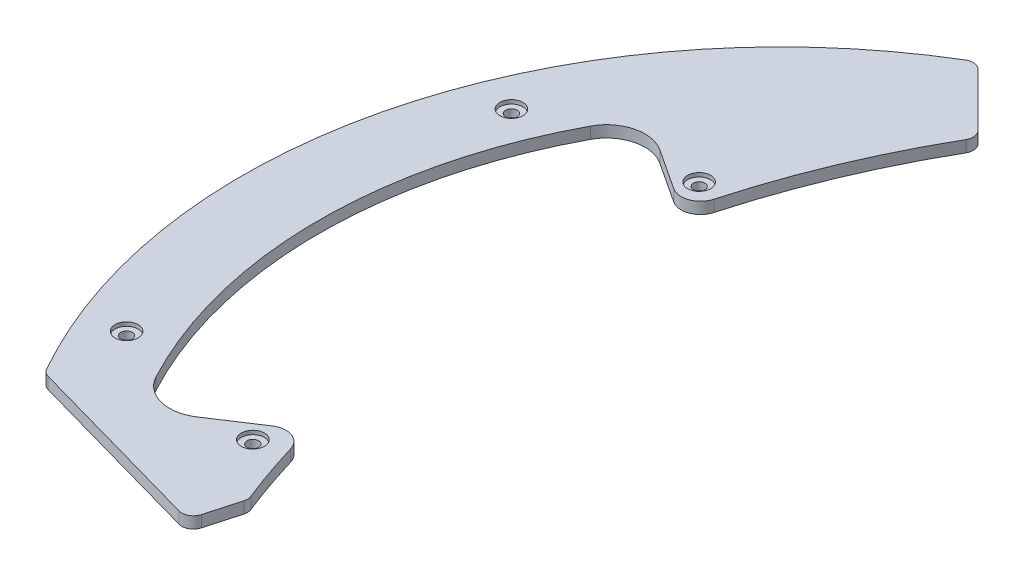
from build123d import *

# Parameters (mm, degrees)
SKETCH1_R               = 140
BOSS_EXTRUDE1_DEPTH     = 3
CUT_EXTRUDE1_REACH      = 200.013
CUT_EXTRUDE3_REACH      = 200.013
SKETCH19_R              = 1.5
CUT_EXTRUDE4_REACH      = 200.013
FILLET2_R               = 10
CUT_EXTRUDE8_DEPTH      = 186.226887897
CUT_EXTRUDE8_DEPTH_BACK = 186.226887897
CUT_EXTRUDE9_REACH      = 187.227
FILLET4_R               = 5
FILLET6_R               = 10
CUT_EXTRUDE10_REACH     = 187.227
SKETCH25_R              = 1.5
FILLET5_R               = 3
SKETCH26_R              = 3
CUT_EXTRUDE11_DEPTH     = 1


with BuildPart() as part:
    # Sketch1 → Boss-Extrude1 (new body)
    with BuildSketch(Plane(origin=(0, 0, 0), x_dir=(1, 0, 0), z_dir=(0, 1, 0))):
        Circle(SKETCH1_R)
    extrude(amount=BOSS_EXTRUDE1_DEPTH)

    # Sketch17 → Cut-Extrude1 (cut, up to next)
    with BuildSketch(Plane.XZ, mode=Mode.PRIVATE) as cut_extrude1_sk1:
        Polygon((-50, 90), (-121.24355653, 70), (-121.24355653, 140), (121.24355653, 140), (121.24355653, 70), (50, 90), align=None)
    cut_extrude1_tool1 = extrude(cut_extrude1_sk1.sketch, amount=-CUT_EXTRUDE1_REACH, mode=Mode.PRIVATE) & part.part
    add(cut_extrude1_tool1.solids().sort_by_distance((0, 0, 111.669853))[0], mode=Mode.SUBTRACT)

    # Sketch19 → Cut-Extrude3 (cut, up to next)
    with BuildSketch(Plane(origin=(0, 3, 0), x_dir=(1, 0, 0), z_dir=(0, 1, 0)), mode=Mode.PRIVATE) as cut_extrude3_sk1:
        with Locations((-79.195959493, -57.982756057)):
            Circle(SKETCH19_R)
    cut_extrude3_tool1 = extrude(cut_extrude3_sk1.sketch, amount=-CUT_EXTRUDE3_REACH, mode=Mode.PRIVATE) & part.part
    # Sketch19 → Cut-Extrude3 (cut, up to next)
    with BuildSketch(Plane(origin=(0, 3, 0), x_dir=(1, 0, 0), z_dir=(0, 1, 0)), mode=Mode.PRIVATE) as cut_extrude3_sk2:
        with Locations((-79.195959493, 57.982756057)):
            Circle(SKETCH19_R)
    cut_extrude3_tool2 = extrude(cut_extrude3_sk2.sketch, amount=-CUT_EXTRUDE3_REACH, mode=Mode.PRIVATE) & part.part
    # Sketch19 → Cut-Extrude3 (cut, up to next)
    with BuildSketch(Plane(origin=(0, 3, 0), x_dir=(1, 0, 0), z_dir=(0, 1, 0)), mode=Mode.PRIVATE) as cut_extrude3_sk3:
        with Locations((79.195959493, 57.982756057)):
            Circle(SKETCH19_R)
    cut_extrude3_tool3 = extrude(cut_extrude3_sk3.sketch, amount=-CUT_EXTRUDE3_REACH, mode=Mode.PRIVATE) & part.part
    # Sketch19 → Cut-Extrude3 (cut, up to next)
    with BuildSketch(Plane(origin=(0, 3, 0), x_dir=(1, 0, 0), z_dir=(0, 1, 0)), mode=Mode.PRIVATE) as cut_extrude3_sk4:
        with Locations((79.195959493, -57.982756057)):
            Circle(SKETCH19_R)
    cut_extrude3_tool4 = extrude(cut_extrude3_sk4.sketch, amount=-CUT_EXTRUDE3_REACH, mode=Mode.PRIVATE) & part.part
    # Sketch19 → Cut-Extrude3 (cut, up to next)
    with BuildSketch(Plane(origin=(0, 3, 0), x_dir=(1, 0, 0), z_dir=(0, 1, 0)), mode=Mode.PRIVATE) as cut_extrude3_sk5:
        with Locations((-57.982756057, 79.195959493)):
            Circle(SKETCH19_R)
    cut_extrude3_tool5 = extrude(cut_extrude3_sk5.sketch, amount=-CUT_EXTRUDE3_REACH, mode=Mode.PRIVATE) & part.part
    # Sketch19 → Cut-Extrude3 (cut, up to next)
    with BuildSketch(Plane(origin=(0, 3, 0), x_dir=(1, 0, 0), z_dir=(0, 1, 0)), mode=Mode.PRIVATE) as cut_extrude3_sk6:
        with Locations((57.982756057, 79.195959493)):
            Circle(SKETCH19_R)
    cut_extrude3_tool6 = extrude(cut_extrude3_sk6.sketch, amount=-CUT_EXTRUDE3_REACH, mode=Mode.PRIVATE) & part.part
    # Sketch19 → Cut-Extrude3 (cut, up to next)
    with BuildSketch(Plane(origin=(0, 3, 0), x_dir=(1, 0, 0), z_dir=(0, 1, 0)), mode=Mode.PRIVATE) as cut_extrude3_sk7:
        with Locations((57.982756057, -79.195959493)):
            Circle(SKETCH19_R)
    cut_extrude3_tool7 = extrude(cut_extrude3_sk7.sketch, amount=-CUT_EXTRUDE3_REACH, mode=Mode.PRIVATE) & part.part
    # Sketch19 → Cut-Extrude3 (cut, up to next)
    with BuildSketch(Plane(origin=(0, 3, 0), x_dir=(1, 0, 0), z_dir=(0, 1, 0)), mode=Mode.PRIVATE) as cut_extrude3_sk8:
        with Locations((-57.982756057, -79.195959493)):
            Circle(SKETCH19_R)
    cut_extrude3_tool8 = extrude(cut_extrude3_sk8.sketch, amount=-CUT_EXTRUDE3_REACH, mode=Mode.PRIVATE) & part.part
    add(cut_extrude3_tool1.solids().sort_by_distance((-79.195959, 3, 57.982756))[0], mode=Mode.SUBTRACT)
    add(cut_extrude3_tool2.solids().sort_by_distance((-79.195959, 3, -57.982756))[0], mode=Mode.SUBTRACT)
    add(cut_extrude3_tool3.solids().sort_by_distance((79.195959, 3, -57.982756))[0], mode=Mode.SUBTRACT)
    add(cut_extrude3_tool4.solids().sort_by_distance((79.195959, 3, 57.982756))[0], mode=Mode.SUBTRACT)
    add(cut_extrude3_tool5.solids().sort_by_distance((-57.982756, 3, -79.195959))[0], mode=Mode.SUBTRACT)
    add(cut_extrude3_tool6.solids().sort_by_distance((57.982756, 3, -79.195959))[0], mode=Mode.SUBTRACT)
    add(cut_extrude3_tool7.solids().sort_by_distance((57.982756, 3, 79.195959))[0], mode=Mode.SUBTRACT)
    add(cut_extrude3_tool8.solids().sort_by_distance((-57.982756, 3, 79.195959))[0], mode=Mode.SUBTRACT)

    # Sketch20 → Cut-Extrude4 (cut, up to next)
    with BuildSketch(Plane(origin=(0, 3, 0), x_dir=(1, 0, 0), z_dir=(0, 1, 0)), mode=Mode.PRIVATE) as cut_extrude4_sk1:
        Polygon((-498.316459894, 549.560016424), (-70, 121.24355653), (-50, 101.24355653), (50, 101.24355653), (70, 121.24355653), (498.316459894, 549.560016424), (498.316459894, 1761.021909565), (-498.316459894, 1761.021909565), align=None)
    cut_extrude4_tool1 = extrude(cut_extrude4_sk1.sketch, amount=-CUT_EXTRUDE4_REACH, mode=Mode.PRIVATE) & part.part
    add(cut_extrude4_tool1.solids().sort_by_distance((0, 3, -1025.243605))[0], mode=Mode.SUBTRACT)

    # Fillet2
    fillet2_edges = [part.edges().sort_by_distance(p)[0] for p in [
        (50, 1.5, -101.24355653),
        (-50, 1.5, -101.24355653),
    ]]
    fillet(fillet2_edges, radius=FILLET2_R)

    # Sketch23 → Cut-Extrude8 (cut, two sides: drawn at the far end of the back side and taken through both)
    with BuildSketch(Plane(origin=(0, 3, 0), x_dir=(1, 0, 0), z_dir=(0, 1, 0)).offset(-CUT_EXTRUDE8_DEPTH_BACK)):
        with BuildLine():
            Line((261.924008605, 637.436261059), (-52.928932188, 104.172488718))
            ThreePointArc((-52.928932188, 104.172488718), (-80.130232259, 17.669229552), (-66.336519501, -71.95475195))
            Line((-66.336519501, -71.95475195), (-73.189737717, -96.367133919))
            Line((-73.189737717, -96.367133919), (-240.56703475, -692.594830068))
            Line((-240.56703475, -692.594830068), (918.053550165, -1130.326301498))
            Line((918.053550165, -1130.326301498), (1420.54459352, 199.704789628))
            Line((1420.54459352, 199.704789628), (261.924008605, 637.436261059))
        make_face()
    extrude(amount=CUT_EXTRUDE8_DEPTH + CUT_EXTRUDE8_DEPTH_BACK, mode=Mode.SUBTRACT)

    # Sketch24 → Cut-Extrude9 (cut, up to next)
    with BuildSketch(Plane(origin=(0, 3, 0), x_dir=(1, 0, 0), z_dir=(0, 1, 0)), mode=Mode.PRIVATE) as cut_extrude9_sk1:
        with BuildLine():
            Line((0, 0), (-100.308962252, 65.864346136))
            ThreePointArc((-100.308962252, 65.864346136), (-120, 0), (-100.308962252, -65.864346136))
            Line((-100.308962252, -65.864346136), (0, 0))
        make_face()
    cut_extrude9_tool1 = extrude(cut_extrude9_sk1.sketch, amount=-CUT_EXTRUDE9_REACH, mode=Mode.PRIVATE) & part.part
    add(cut_extrude9_tool1.solids().sort_by_distance((-75.574375, 3, 0))[0], mode=Mode.SUBTRACT)

    # Fillet4
    fillet4_edges = [part.edges().sort_by_distance(p)[0] for p in [
        (-74.063830686, 1.5, 48.63140512),
        (-75.142204111, 1.5, -49.339481038),
    ]]
    fillet(fillet4_edges, radius=FILLET4_R)

    # Fillet6
    fillet6_edges = [part.edges().sort_by_distance(p)[0] for p in [
        (-100.308962252, 1.5, -65.864346136),
        (-100.308962252, 1.5, 65.864346136),
    ]]
    fillet(fillet6_edges, radius=FILLET6_R)

    # Sketch25 → Cut-Extrude10 (cut, up to next)
    with BuildSketch(Plane(origin=(0, 3, 0), x_dir=(1, 0, 0), z_dir=(0, 1, 0)), mode=Mode.PRIVATE) as cut_extrude10_sk1:
        with Locations((-120, 50)):
            Circle(SKETCH25_R)
    cut_extrude10_tool1 = extrude(cut_extrude10_sk1.sketch, amount=-CUT_EXTRUDE10_REACH, mode=Mode.PRIVATE) & part.part
    # Sketch25 → Cut-Extrude10 (cut, up to next)
    with BuildSketch(Plane(origin=(0, 3, 0), x_dir=(1, 0, 0), z_dir=(0, 1, 0)), mode=Mode.PRIVATE) as cut_extrude10_sk2:
        with Locations((-120, -50)):
            Circle(SKETCH25_R)
    cut_extrude10_tool2 = extrude(cut_extrude10_sk2.sketch, amount=-CUT_EXTRUDE10_REACH, mode=Mode.PRIVATE) & part.part
    add(cut_extrude10_tool1.solids().sort_by_distance((-120, 3, -50))[0], mode=Mode.SUBTRACT)
    add(cut_extrude10_tool2.solids().sort_by_distance((-120, 3, 50))[0], mode=Mode.SUBTRACT)

    # Fillet5
    fillet5_edges = [part.edges().sort_by_distance(p)[0] for p in [
        (-70, 1.5, -121.24355653),
        (-66.336519501, 1.5, 71.95475195),
        (-69.838855295, 1.5, 84.430694855),
        (-121.24355653, 1.5, 70),
        (-52.928932188, 1.5, -104.172488718),
    ]]
    fillet(fillet5_edges, radius=FILLET5_R)

    # Sketch26 → Cut-Extrude11 (cut)
    with BuildSketch(Plane(origin=(0, 3, 0), x_dir=(1, 0, 0), z_dir=(0, 1, 0))):
        with Locations((-79.195959493, 57.982756057)):
            Circle(SKETCH26_R)
        with Locations((-120, 50)):
            Circle(SKETCH26_R)
        with Locations((-120, -50)):
            Circle(SKETCH26_R)
        with Locations((-79.195959493, -57.982756057)):
            Circle(SKETCH26_R)
    extrude(amount=-CUT_EXTRUDE11_DEPTH, mode=Mode.SUBTRACT)


solid = part.part
